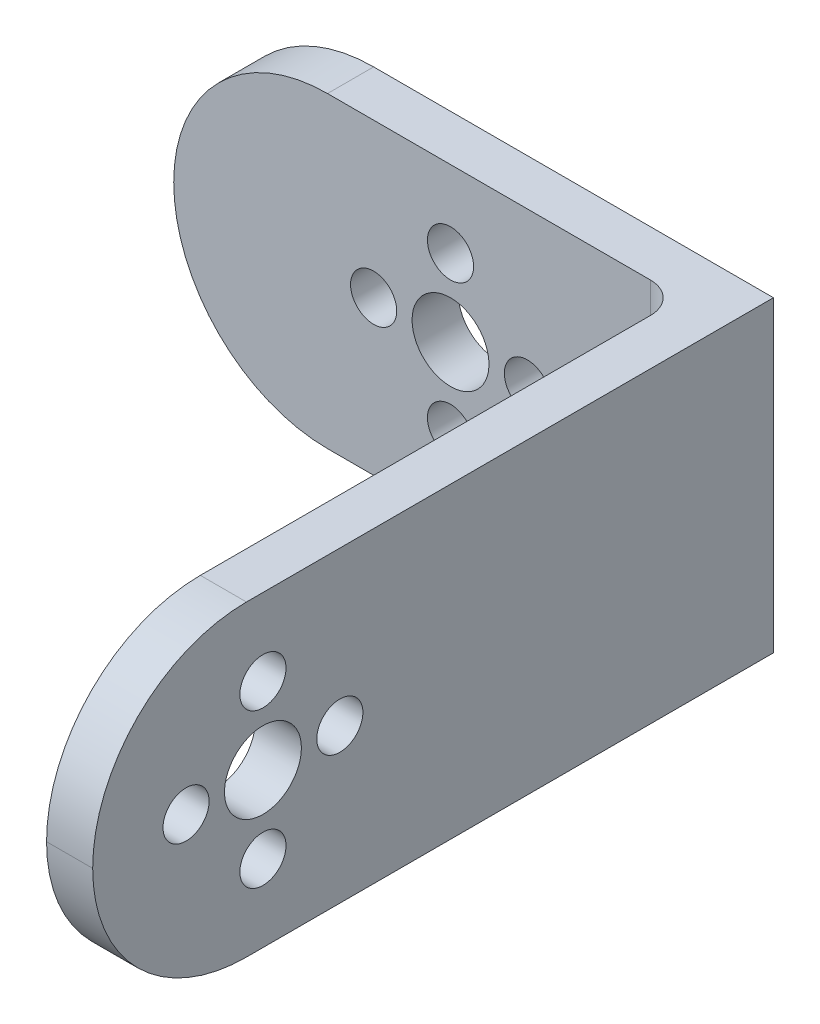
from build123d import *

# Parameters (mm, degrees)
ESQUISSE1_W             = 3
ESQUISSE1_H             = 20
BOSS_EXTRU_1_DEPTH      = 41.27
ESQUISSE1_3_W           = 36
ESQUISSE1_3_H           = 20
BOSS_EXTRU_2_DEPTH      = 3
ESQUISSE3_R             = 1.5
ESQUISSE3_R_2           = 2.5
ENL_V_MAT_EXTRU_2_DEPTH = 85
CONG_2_R                = 2
CONG_3_R                = 10
ESQUISSE7_R             = 1.5
ESQUISSE7_R_2           = 2.5
ENL_V_MAT_EXTRU_3_DEPTH = 10


with BuildPart() as part:
    # Esquisse1 → Boss.-Extru.1 (new body)
    with BuildSketch(Plane.XY):
        with Locations((34.5, 10)):
            Rectangle(ESQUISSE1_W, ESQUISSE1_H)
    extrude(amount=BOSS_EXTRU_1_DEPTH)

    # Esquisse1<3> → Boss.-Extru.2 (add)
    with BuildSketch(Plane.XY):
        with Locations((18, 10)):
            Rectangle(ESQUISSE1_3_W, ESQUISSE1_3_H)
    extrude(amount=-BOSS_EXTRU_2_DEPTH)

    # Esquisse3 → Enlèv. mat.-Extru.2 (cut)
    with BuildSketch(Plane(origin=(36, 0, 0), x_dir=(0, 0, -1), z_dir=(1, 0, 0))):
        with Locations((-30.197874881, 15)):
            Circle(ESQUISSE3_R)
        with Locations((-30.197874881, 5)):
            Circle(ESQUISSE3_R)
        with Locations((-35.197874881, 10)):
            Circle(ESQUISSE3_R)
        with Locations((-25.197874881, 10)):
            Circle(ESQUISSE3_R)
        with Locations((-30.197874881, 10)):
            Circle(ESQUISSE3_R_2)
    extrude(amount=-ENL_V_MAT_EXTRU_2_DEPTH, mode=Mode.SUBTRACT)

    # Congé2
    cong_2_edges = [part.edges().sort_by_distance(p)[0] for p in [
        (33, 10, 0),
    ]]
    fillet(cong_2_edges, radius=CONG_2_R)

    # Congé3
    cong_3_edges = [part.edges().sort_by_distance(p)[0] for p in [
        (0, 20, -1.5),
        (0, 0, -1.5),
        (34.5, 20, 41.27),
        (34.5, 0, 41.27),
    ]]
    fillet(cong_3_edges, radius=CONG_3_R - 0.0001)  # a hair under: the kernel refuses the full size

    # Esquisse7 → Enlèv. mat.-Extru.3 (cut)
    with BuildSketch(Plane(origin=(0, 0, -3), x_dir=(-1, 0, 0), z_dir=(0, 0, -1))):
        with Locations((-23, 10)):
            Circle(ESQUISSE7_R)
        with Locations((-18, 15)):
            Circle(ESQUISSE7_R)
        with Locations((-13, 10)):
            Circle(ESQUISSE7_R)
        with Locations((-18, 5)):
            Circle(ESQUISSE7_R)
        with Locations((-18, 10)):
            Circle(ESQUISSE7_R_2)
    extrude(amount=-ENL_V_MAT_EXTRU_3_DEPTH, mode=Mode.SUBTRACT)


solid = part.part
